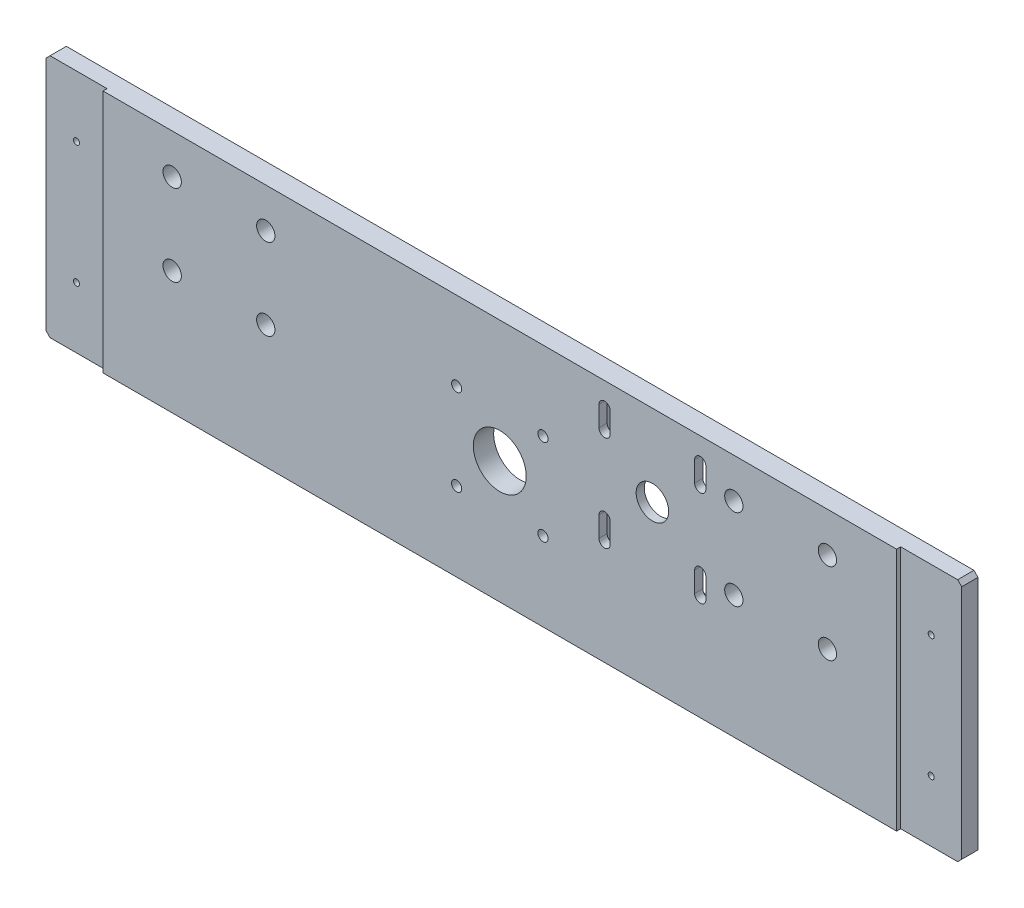
from build123d import *

# Parameters (mm, degrees)
SCHIZZO1_R                   = 13
SCHIZZO1_R_2                 = 2.5
SCHIZZO1_R_3                 = 4.5
SCHIZZO1_R_4                 = 1.5
SCHIZZO1_R_5                 = 8
ESTRUSIONE_ESTRUSIONE1_DEPTH = 10
SCHIZZO2_W                   = 30
SCHIZZO2_H                   = 120
TAGLIO_ESTRUSIONE1_DEPTH     = 2
SCHIZZO3_W                   = 60
SCHIZZO3_H                   = 72
TAGLIO_ESTRUSIONE2_DEPTH     = 6


with BuildPart() as part:
    # Schizzo1 → Estrusione-Estrusione1 (new body)
    with BuildSketch(Plane.XY):
        Polygon((2, 0), (448, 0), (450, 2), (450, 118), (448, 120), (2, 120), (0, 118), (0, 2), align=None)
        with Locations((225, 60)):
            Circle(SCHIZZO1_R, mode=Mode.SUBTRACT)
        with Locations((246.213203436, 81.213203436)):
            Circle(SCHIZZO1_R_2, mode=Mode.SUBTRACT)
        with Locations((386, 100.5)):
            Circle(SCHIZZO1_R_3, mode=Mode.SUBTRACT)
        with Locations((246.213203436, 38.786796564)):
            Circle(SCHIZZO1_R_2, mode=Mode.SUBTRACT)
        with Locations((203.786796564, 38.786796564)):
            Circle(SCHIZZO1_R_2, mode=Mode.SUBTRACT)
        with Locations((110, 100.5)):
            Circle(SCHIZZO1_R_3, mode=Mode.SUBTRACT)
        with Locations((110, 60.5)):
            Circle(SCHIZZO1_R_3, mode=Mode.SUBTRACT)
        with Locations((64, 60.5)):
            Circle(SCHIZZO1_R_3, mode=Mode.SUBTRACT)
        with Locations((64, 100.5)):
            Circle(SCHIZZO1_R_3, mode=Mode.SUBTRACT)
        with Locations((386, 60.5)):
            Circle(SCHIZZO1_R_3, mode=Mode.SUBTRACT)
        with Locations((15, 30)):
            Circle(SCHIZZO1_R_4, mode=Mode.SUBTRACT)
        with Locations((435, 30)):
            Circle(SCHIZZO1_R_4, mode=Mode.SUBTRACT)
        with Locations((203.786796564, 81.213203436)):
            Circle(SCHIZZO1_R_2, mode=Mode.SUBTRACT)
        with Locations((340, 60.5)):
            Circle(SCHIZZO1_R_3, mode=Mode.SUBTRACT)
        with Locations((340, 100.5)):
            Circle(SCHIZZO1_R_3, mode=Mode.SUBTRACT)
        with Locations((435, 90)):
            Circle(SCHIZZO1_R_4, mode=Mode.SUBTRACT)
        with Locations((15, 90)):
            Circle(SCHIZZO1_R_4, mode=Mode.SUBTRACT)
        with Locations((300, 80)):
            Circle(SCHIZZO1_R_5, mode=Mode.SUBTRACT)
        with BuildLine():
            Line((320.75, 108.5), (320.75, 98.5))
            ThreePointArc((320.75, 98.5), (323.5, 95.75), (326.25, 98.5))
            Line((326.25, 98.5), (326.25, 108.5))
            ThreePointArc((326.25, 108.5), (323.5, 111.25), (320.75, 108.5))
        make_face(mode=Mode.SUBTRACT)
        with BuildLine():
            Line((279.25, 108.5), (279.25, 98.5))
            ThreePointArc((279.25, 98.5), (276.5, 95.75), (273.75, 98.5))
            Line((273.75, 98.5), (273.75, 108.5))
            ThreePointArc((273.75, 108.5), (276.5, 111.25), (279.25, 108.5))
        make_face(mode=Mode.SUBTRACT)
        with BuildLine():
            Line((320.75, 51.5), (320.75, 61.5))
            ThreePointArc((320.75, 61.5), (323.5, 64.25), (326.25, 61.5))
            Line((326.25, 61.5), (326.25, 51.5))
            ThreePointArc((326.25, 51.5), (323.5, 48.75), (320.75, 51.5))
        make_face(mode=Mode.SUBTRACT)
        with BuildLine():
            Line((279.25, 51.5), (279.25, 61.5))
            ThreePointArc((279.25, 61.5), (276.5, 64.25), (273.75, 61.5))
            Line((273.75, 61.5), (273.75, 51.5))
            ThreePointArc((273.75, 51.5), (276.5, 48.75), (279.25, 51.5))
        make_face(mode=Mode.SUBTRACT)
    extrude(amount=-ESTRUSIONE_ESTRUSIONE1_DEPTH)

    # Schizzo2 → Taglio-Estrusione1 (cut)
    with BuildSketch(Plane.XY):
        with Locations((15, 60)):
            Rectangle(SCHIZZO2_W, SCHIZZO2_H)
        with Locations((615.438855383, 60)):
            Rectangle(SCHIZZO2_W, SCHIZZO2_H)
        with Locations((435, 60)):
            Rectangle(SCHIZZO2_W, SCHIZZO2_H)
    extrude(amount=-TAGLIO_ESTRUSIONE1_DEPTH, mode=Mode.SUBTRACT)

    # Schizzo3 → Taglio-Estrusione2 (cut)
    with BuildSketch(Plane(origin=(0, 0, -10), x_dir=(-1, 0, 0), z_dir=(0, 0, -1))):
        with Locations((-300, 80)):
            Rectangle(SCHIZZO3_W, SCHIZZO3_H)
    extrude(amount=-TAGLIO_ESTRUSIONE2_DEPTH, mode=Mode.SUBTRACT)


solid = part.part
